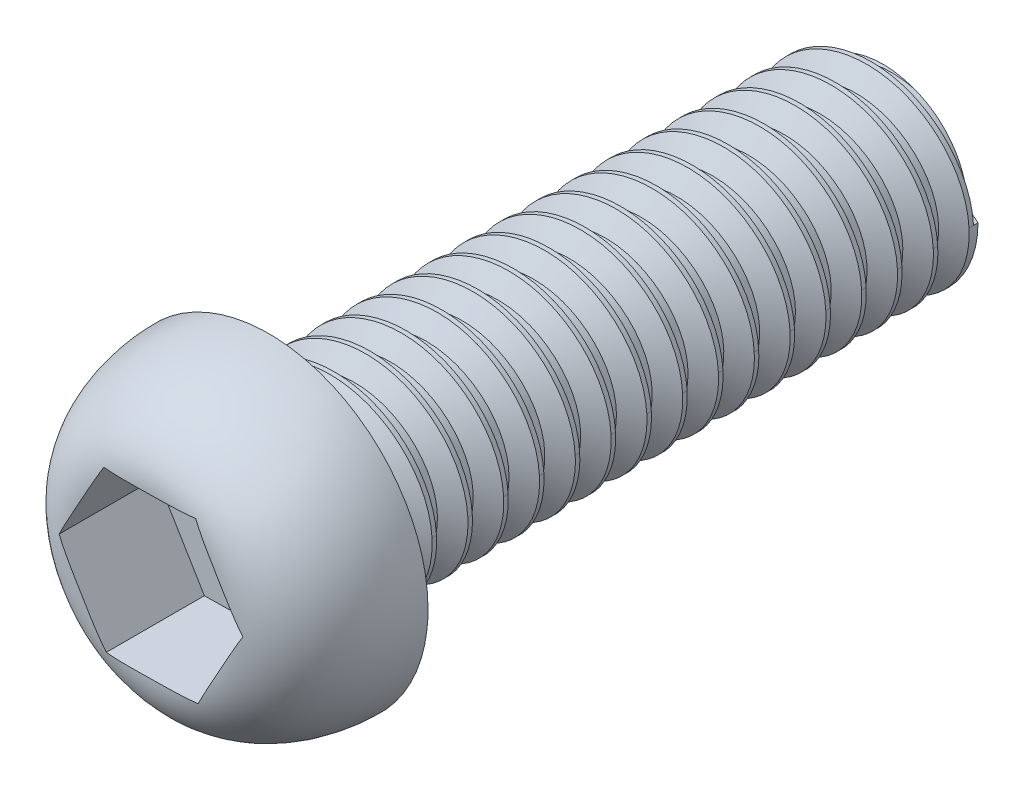
from build123d import *

# Parameters (mm, degrees)
SKETCH1_R           = 1.25
BOSS_EXTRUDE1_DEPTH = 8
SKETCH2_R           = 2
BOSS_EXTRUDE2_DEPTH = 1.5
FILLET1_SIZE        = 1.5
FILLET1_SIZE_2      = 1
CUT_EXTRUDE1_DEPTH  = 1.25
THREAD2_PITCH       = 0.45


with BuildPart() as part:
    # Sketch1 → Boss-Extrude1 (new body)
    with BuildSketch(Plane.XY):
        Circle(SKETCH1_R)
    extrude(amount=BOSS_EXTRUDE1_DEPTH)

    # Sketch2 → Boss-Extrude2 (add)
    with BuildSketch(Plane.XY.offset(8)):
        Circle(SKETCH2_R)
    extrude(amount=BOSS_EXTRUDE2_DEPTH)

    # Fillet1
    # an asymmetric fillet: 1.5, 1 mm, written as the material it takes off along each edge
    with BuildSketch(Plane(origin=(0, 0, 9.5), x_dir=(1, 0, 0), z_dir=(0, -1, 0))) as fillet1_piece_1:
        with BuildLine():
            Bezier((2, -FILLET1_SIZE), (2, 0), (2 - FILLET1_SIZE_2, 0), weights=[1, 0.707106781, 1])
            Line((2 - FILLET1_SIZE_2, 0), (2, 0))
            Line((2, 0), (2, -FILLET1_SIZE))
        make_face()
    revolve(axis=Axis((0, 0, 9.5), (0, 0, 1)), mode=Mode.SUBTRACT)

    # Sketch3 → Cut-Extrude1 (cut)
    with BuildSketch(Plane.XY.offset(9.5)):
        Polygon((1.154558496, 0.01811109), (0.561594584, 1.008932533), (-0.592963912, 0.990821443), (-1.154558496, -0.01811109), (-0.561594584, -1.008932533), (0.592963912, -0.990821443), align=None)
    extrude(amount=-CUT_EXTRUDE1_DEPTH, mode=Mode.SUBTRACT)

    # Thread2: the profile of Thread Profile1 profile screwed along a right-hand helix of 16.888889 turns, 6 arcs to a turn; built about Z, then put on its axis
    thread2_z = Axis((0, 0, 0), (0, 0, 1))
    thread2_corners = [(1.2503, 0, -0.000173205), (1.2503, 0, 0.393923204), (1.006430356, 0, 0.253124999), (1.006430356, 0, 0.140624999)]
    with BuildLine(mode=Mode.PRIVATE) as thread2_profile:
        Line(thread2_corners[0], thread2_corners[1])
        Line(thread2_corners[1], thread2_corners[2])
        Line(thread2_corners[2], thread2_corners[3])
        Line(thread2_corners[3], thread2_corners[0])
    thread2_cap = Face(thread2_profile.wire())
    thread2_turn_angles = [0, 30, 60, 90, 120, 150, 180, 210, 240, 270, 300, 330, 360]
    thread2_turn_weights = [1, 0.8660254037844387, 1, 0.8660254037844387, 1, 0.8660254037844387, 1, 0.8660254037844387, 1, 0.8660254037844387, 1, 0.8660254037844387, 1]
    thread2_turn_rails = [Edge.make_bspline([Vector(p[0], p[1], 0).rotate(thread2_z, thread2_turn_angles[k]) / thread2_turn_weights[k] + Vector(0, 0, p[2] + THREAD2_PITCH * thread2_turn_angles[k] / 360) for k in range(13)], [0, 0, 0, 1, 1, 2, 2, 3, 3, 4, 4, 5, 5, 6, 6, 6], 2, thread2_turn_weights) for p in thread2_corners]
    thread2_turn_sides = [Face.make_surface_from_curves(thread2_turn_rails[p[0]], thread2_turn_rails[p[1]]) for p in [(0, 1), (1, 2), (2, 3), (3, 0)]]
    thread2_last_angles = [5760, 5790, 5820, 5850, 5880, 5910, 5940, 5970, 6000, 6030, 6060, 6070, 6080]
    thread2_last_weights = [1, 0.8660254037844387, 1, 0.8660254037844387, 1, 0.8660254037844387, 1, 0.8660254037844387, 1, 0.8660254037844387, 1, 0.9848077530122067, 1]
    thread2_last_rails = [Edge.make_bspline([Vector(p[0], p[1], 0).rotate(thread2_z, thread2_last_angles[k]) / thread2_last_weights[k] + Vector(0, 0, p[2] + THREAD2_PITCH * thread2_last_angles[k] / 360) for k in range(13)], [0, 0, 0, 1, 1, 2, 2, 3, 3, 4, 4, 5, 5, 6, 6, 6], 2, thread2_last_weights) for p in thread2_corners]
    thread2_last_sides = [Face.make_surface_from_curves(thread2_last_rails[p[0]], thread2_last_rails[p[1]]) for p in [(0, 1), (1, 2), (2, 3), (3, 0)]]
    thread2 = Plane(origin=(0, 0, 0), x_dir=(1, 0, 0), z_dir=(0, 0, 1)) * Solid(Shell([*[p.moved(Location((0, 0, THREAD2_PITCH * i))) for i in range(16) for p in thread2_turn_sides], *thread2_last_sides, thread2_cap, thread2_cap.rotate(thread2_z, 6080).moved(Location((0, 0, THREAD2_PITCH * 6080 / 360)))]))
    add(thread2, mode=Mode.SUBTRACT)

    # Sketch11 → Cut-Revolve1 (revolve, cut)
    with BuildSketch(Plane(origin=(0, 0, 0), x_dir=(1, 0, 0), z_dir=(0, 1, 0)), mode=Mode.PRIVATE) as cut_revolve1_sk:
        Polygon((-0.497011249, 0), (-1.365689054, -0.389182506), (-1.457568437, 0.187151807), (-0.497011249, 0.187151807), align=None)
    revolve(cut_revolve1_sk.sketch.rotate(Axis((0, 0, 8), (0, 0, -1)), 180), axis=Axis((0, 0, 8), (0, 0, -1)), mode=Mode.SUBTRACT)


solid = part.part
